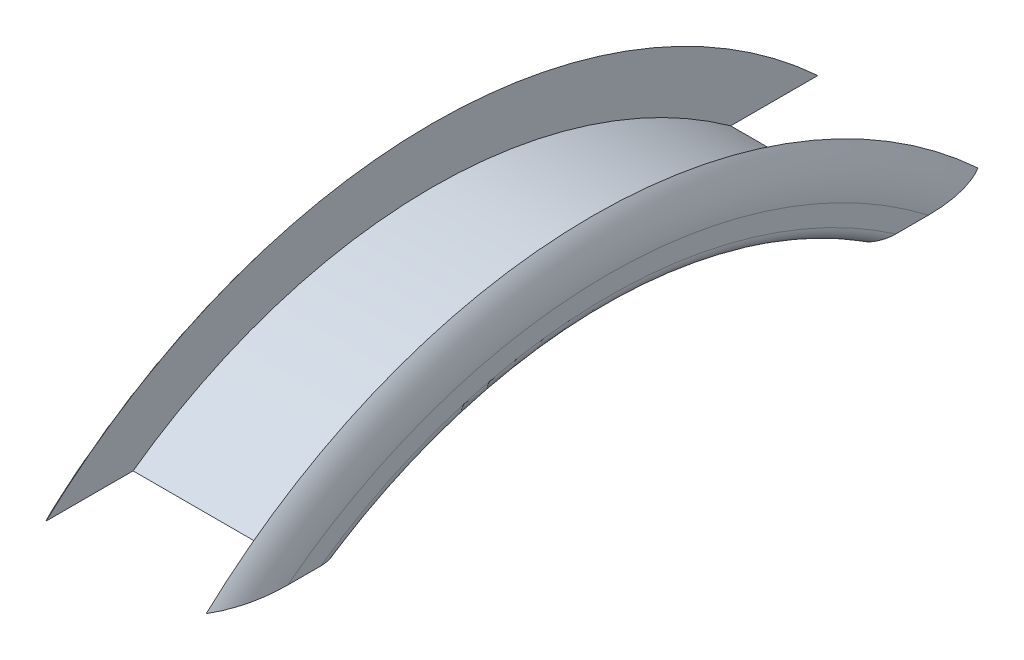
from build123d import *

# Parameters (mm, degrees)
CUT_EXTRUDE_1_DEPTH = 193.829760684


with BuildPart() as part:
    # Эскиз1 → Повернуть1 (revolve)
    with BuildSketch(Plane.XY):
        with BuildLine():
            Line((-12.5, 8.614378278), (-12.5, 0))
            Line((-12.5, 0), (12.5, 0))
            Line((12.5, 0), (12.5, 8.614378278))
            ThreePointArc((12.5, 8.614378278), (14.354143467, 5.535533906), (15, 2))
            Line((15, 2), (15, -1))
            ThreePointArc((15, -1), (14.414213562, -2.414213562), (13, -3))
            Line((13, -3), (-13, -3))
            ThreePointArc((-13, -3), (-14.414213562, -2.414213562), (-15, -1))
            Line((-15, -1), (-15, 2))
            ThreePointArc((-15, 2), (-14.354143467, 5.535533906), (-12.5, 8.614378278))
        make_face()
    revolve(axis=Axis((-34.958768078, -80, 0), (1, 0, 0)))

    # Эскиз2 → Вырез-Вытянуть1 (cut, through all)
    with BuildSketch(Plane(origin=(15, 0, 0), x_dir=(0, 0, -1), z_dir=(1, 0, 0))):
        Polygon((-498.021589134, -15), (-60.228797411, -15), (60.228797411, -15), (498.021589134, -15), (498.021589134, -890.585583447), (-498.021589134, -890.585583447), align=None)
    extrude(amount=-CUT_EXTRUDE_1_DEPTH, mode=Mode.SUBTRACT)


solid = part.part
